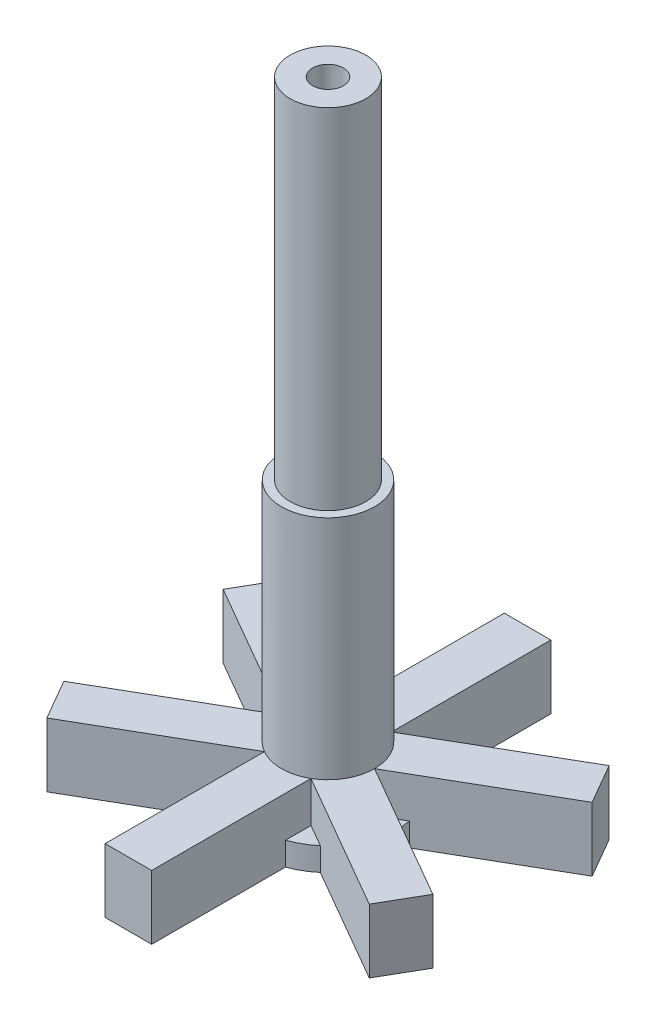
from build123d import *

# Parameters (mm, degrees)
BOSS_EXTRUDE1_DEPTH = 25
SKETCH1_4_R         = 4
BOSS_EXTRUDE3_DEPTH = 2
BOSS_EXTRUDE2_DEPTH = 5.5
SKETCH2_R           = 3.25
BOSS_EXTRUDE6_DEPTH = 30
SKETCH3_R           = 1.325
CUT_EXTRUDE1_DEPTH  = 10


with BuildPart() as part:
    # Sketch1 → Boss-Extrude1 (new body)
    with BuildSketch(Plane(origin=(0, 0, 0), x_dir=(1, 0, 0), z_dir=(0, 1, 0))):
        with BuildLine():
            ThreePointArc((-4, 0), (-3.464101615, -2), (-2, -3.464101615))
            ThreePointArc((-2, -3.464101615), (0, -4), (2, -3.464101615))
            ThreePointArc((2, -3.464101615), (3.464101615, -2), (4, 0))
            ThreePointArc((4, 0), (3.464101615, 2), (2, 3.464101615))
            ThreePointArc((2, 3.464101615), (0, 4), (-2, 3.464101615))
            ThreePointArc((-2, 3.464101615), (-3.464101615, 2), (-4, 0))
        make_face()
    extrude(amount=BOSS_EXTRUDE1_DEPTH)

    # Sketch1<4> → Boss-Extrude3 (add)
    with BuildSketch(Plane(origin=(0, 0, 0), x_dir=(1, 0, 0), z_dir=(0, 1, 0))):
        with BuildLine():
            Line((-2, -5.656854249), (2, -5.656854249))
            ThreePointArc((2, -5.656854249), (3, -5.196152423), (3.898979486, -4.560477932))
            Line((3.898979486, -4.560477932), (5.898979486, -1.096376317))
            ThreePointArc((5.898979486, -1.096376317), (6, 0), (5.898979486, 1.096376317))
            Line((5.898979486, 1.096376317), (3.898979486, 4.560477932))
            ThreePointArc((3.898979486, 4.560477932), (3, 5.196152423), (2, 5.656854249))
            Line((2, 5.656854249), (-2, 5.656854249))
            ThreePointArc((-2, 5.656854249), (-3, 5.196152423), (-3.898979486, 4.560477932))
            Line((-3.898979486, 4.560477932), (-5.898979486, 1.096376317))
            ThreePointArc((-5.898979486, 1.096376317), (-6, 0), (-5.898979486, -1.096376317))
            Line((-5.898979486, -1.096376317), (-3.898979486, -4.560477932))
            ThreePointArc((-3.898979486, -4.560477932), (-3, -5.196152423), (-2, -5.656854249))
        make_face()
        Circle(SKETCH1_4_R, mode=Mode.SUBTRACT)
    extrude(amount=BOSS_EXTRUDE3_DEPTH)

    # Sketch1<3> → Boss-Extrude2 (add)
    with BuildSketch(Plane(origin=(0, 0, 0), x_dir=(1, 0, 0), z_dir=(0, 1, 0))):
        with BuildLine():
            Line((-2, -3.464101615), (-2, -17.156854249))
            Line((-2, -17.156854249), (2, -17.156854249))
            Line((2, -17.156854249), (2, -3.464101615))
            ThreePointArc((2, -3.464101615), (0, -4), (-2, -3.464101615))
        make_face()
        with BuildLine():
            ThreePointArc((-2, -3.464101615), (-3.464101615, -2), (-4, 0))
            Line((-4, 0), (-15.858271629, -6.846376317))
            Line((-15.858271629, -6.846376317), (-13.858271629, -10.310477932))
            Line((-13.858271629, -10.310477932), (-2, -3.464101615))
        make_face()
        with BuildLine():
            ThreePointArc((4, 0), (3.464101615, -2), (2, -3.464101615))
            Line((2, -3.464101615), (13.858271629, -10.310477932))
            Line((13.858271629, -10.310477932), (15.858271629, -6.846376317))
            Line((15.858271629, -6.846376317), (4, 0))
        make_face()
        with BuildLine():
            ThreePointArc((-4, 0), (-3.464101615, 2), (-2, 3.464101615))
            Line((-2, 3.464101615), (-13.858271629, 10.310477932))
            Line((-13.858271629, 10.310477932), (-15.858271629, 6.846376317))
            Line((-15.858271629, 6.846376317), (-4, 0))
        make_face()
        with BuildLine():
            ThreePointArc((2, 3.464101615), (3.464101615, 2), (4, 0))
            Line((4, 0), (15.858271629, 6.846376317))
            Line((15.858271629, 6.846376317), (13.858271629, 10.310477932))
            Line((13.858271629, 10.310477932), (2, 3.464101615))
        make_face()
        with BuildLine():
            ThreePointArc((-2, 3.464101615), (0, 4), (2, 3.464101615))
            Line((2, 3.464101615), (2, 17.156854249))
            Line((2, 17.156854249), (-2, 17.156854249))
            Line((-2, 17.156854249), (-2, 3.464101615))
        make_face()
    extrude(amount=BOSS_EXTRUDE2_DEPTH)

    # Sketch2 → Boss-Extrude6 (add)
    with BuildSketch(Plane(origin=(0, 25, 0), x_dir=(1, 0, 0), z_dir=(0, 1, 0))):
        Circle(SKETCH2_R)
    extrude(amount=BOSS_EXTRUDE6_DEPTH)

    # Sketch3 → Cut-Extrude1 (cut)
    with BuildSketch(Plane(origin=(0, 55, 0), x_dir=(1, 0, 0), z_dir=(0, 1, 0))):
        Circle(SKETCH3_R)
    extrude(amount=-CUT_EXTRUDE1_DEPTH, mode=Mode.SUBTRACT)


solid = part.part
